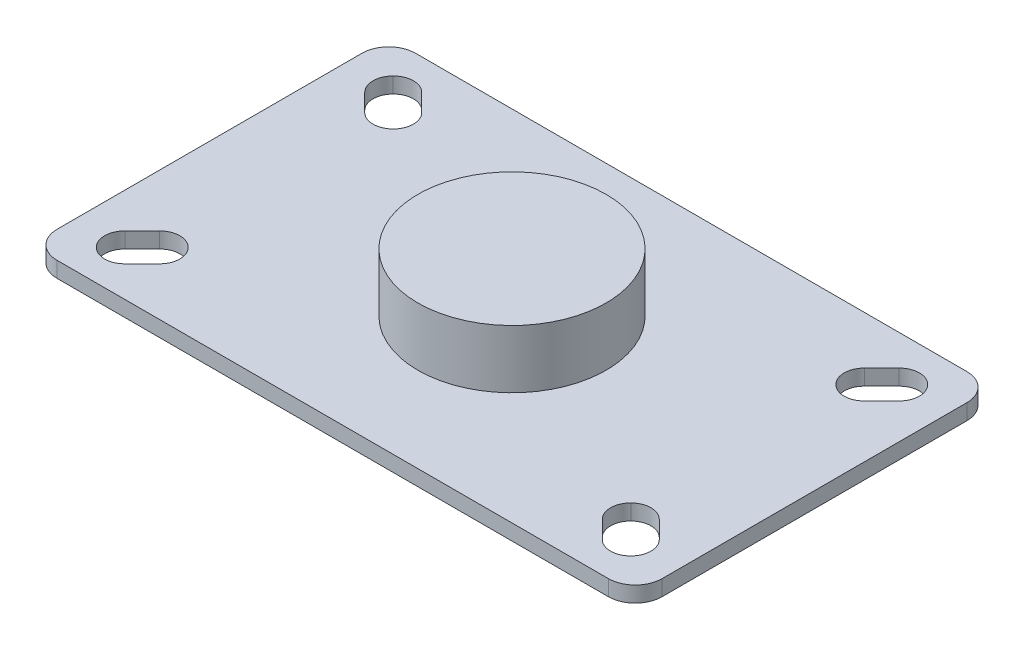
from build123d import *

# Parameters (mm, degrees)
SKETCH1_W           = 135
SKETCH1_H           = 80
BOSS_EXTRUDE1_DEPTH = 3.5
SKETCH2_R           = 21
BOSS_EXTRUDE2_DEPTH = 13
CUT_EXTRUDE1_DEPTH  = 80.531440324
FILLET1_R           = 6
FILLET2_R           = 4.5


with BuildPart() as part:
    # Sketch1 → Boss-Extrude1 (new body)
    with BuildSketch(Plane(origin=(0, 0, 0), x_dir=(1, 0, 0), z_dir=(0, 1, 0))):
        Rectangle(SKETCH1_W, SKETCH1_H)
    extrude(amount=BOSS_EXTRUDE1_DEPTH)

    # Sketch2 → Boss-Extrude2 (add)
    with BuildSketch(Plane(origin=(0, 3.5, 0), x_dir=(1, 0, 0), z_dir=(0, 1, 0))):
        with Locations(Location((0, 0, 0), (0, 0, 90))):
            Circle(SKETCH2_R)
    extrude(amount=BOSS_EXTRUDE2_DEPTH)

    # Sketch4 → Cut-Extrude1 (cut, through all)
    with BuildSketch(Plane(origin=(0, 3.5, 0), x_dir=(1, 0, 0), z_dir=(0, 1, 0))):
        Polygon((46.191495321, -26.055456352), (56.444543648, -36.308504679), (62.808504679, -29.944543648), (52.555456352, -19.691495321), align=None)
        Polygon((-56.444543648, 36.308504679), (-46.191495321, 26.055456352), (-52.555456352, 19.691495321), (-62.808504679, 29.944543648), align=None)
        Polygon((62.808504679, 29.944543648), (56.444543648, 36.308504679), (46.191495321, 26.055456352), (52.555456352, 19.691495321), align=None)
        Polygon((-62.808504679, -29.944543648), (-52.555456352, -19.691495321), (-46.191495321, -26.055456352), (-56.444543648, -36.308504679), align=None)
    extrude(amount=-CUT_EXTRUDE1_DEPTH, mode=Mode.SUBTRACT)

    # Fillet1
    fillet1_edges = [part.edges().sort_by_distance(p)[0] for p in [
        (67.5, 1.75, 40),
        (-67.5, 1.75, 40),
        (-67.5, 1.75, -40),
        (67.5, 1.75, -40),
    ]]
    fillet(fillet1_edges, radius=FILLET1_R)

    # Fillet2
    fillet2_edges = [part.edges().sort_by_distance(p)[0] for p in [
        (56.444543648, 1.75, -36.308504679),
        (52.555456352, 1.75, 19.691495321),
        (46.191495321, 1.75, -26.055456352),
        (46.191495321, 1.75, 26.055456352),
        (52.555456352, 1.75, -19.691495321),
        (56.444543648, 1.75, 36.308504679),
        (62.808504679, 1.75, -29.944543648),
        (62.808504679, 1.75, 29.944543648),
        (-52.555456352, 1.75, 19.691495321),
        (-46.191495321, 1.75, 26.055456352),
        (-46.191495321, 1.75, -26.055456352),
        (-52.555456352, 1.75, -19.691495321),
        (-56.444543648, 1.75, 36.308504679),
        (-62.808504679, 1.75, 29.944543648),
        (-62.808504679, 1.75, -29.944543648),
        (-56.444543648, 1.75, -36.308504679),
    ]]
    fillet(fillet2_edges, radius=FILLET2_R - 0.0001)  # a hair under: the kernel refuses the full size


solid = part.part
